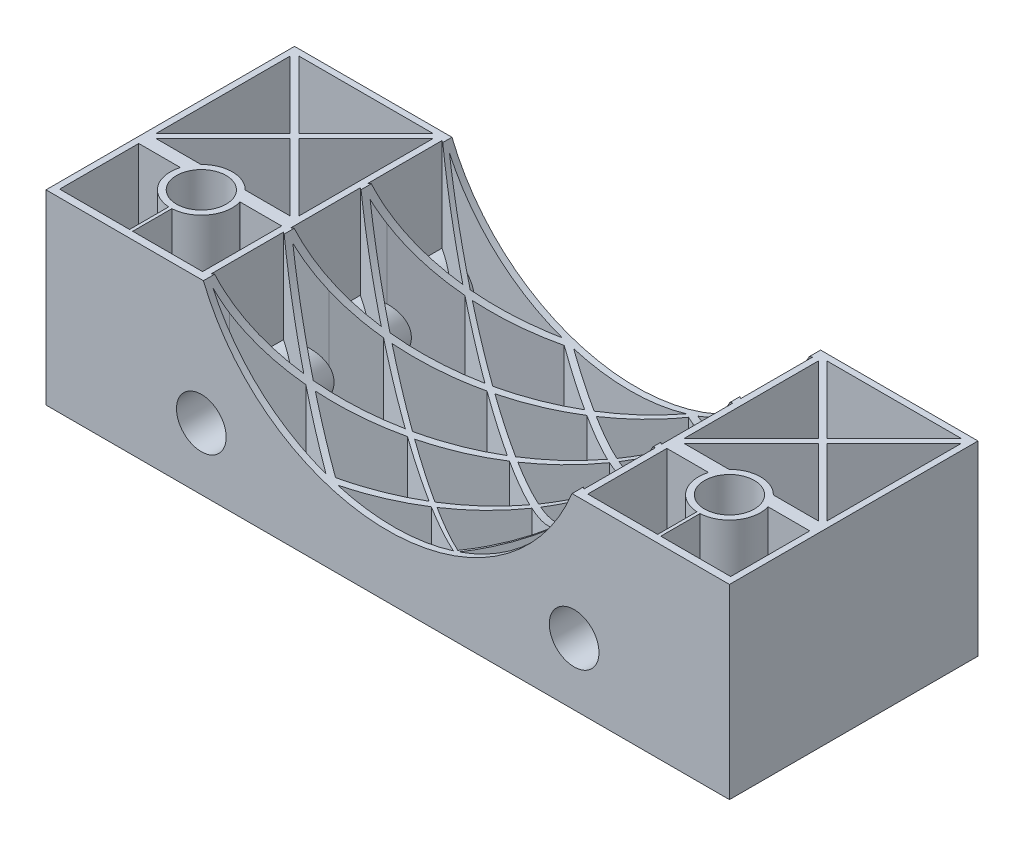
from build123d import *

# Parameters (mm, degrees)
SKETCH1_W           = 110
SKETCH1_H           = 40
BOSS_EXTRUDE1_DEPTH = 30
SKETCH2_R           = 32
CUT_EXTRUDE1_DEPTH  = 40
SKETCH3_R           = 4
CUT_EXTRUDE3_DEPTH  = 30
SKETCH7_R           = 4
CUT_EXTRUDE6_DEPTH  = 40
CUT_EXTRUDE7_DEPTH  = 30
CUT_EXTRUDE9_DEPTH  = 30
SKETCH12_R          = 5
BOSS_EXTRUDE3_DEPTH = 40
SKETCH15_R          = 4
CUT_EXTRUDE10_DEPTH = 40


with BuildPart() as part:
    # Sketch1 → Boss-Extrude1 (new body)
    with BuildSketch(Plane(origin=(0, 0, 0), x_dir=(1, 0, 0), z_dir=(0, 1, 0))):
        with Locations((55, 20)):
            Rectangle(SKETCH1_W, SKETCH1_H)
    extrude(amount=BOSS_EXTRUDE1_DEPTH)

    # Sketch2 → Cut-Extrude1 (cut)
    with BuildSketch(Plane.XY):
        with Locations((55, 42)):
            Circle(SKETCH2_R)
    extrude(amount=-CUT_EXTRUDE1_DEPTH, mode=Mode.SUBTRACT)

    # Sketch3 → Cut-Extrude3 (cut)
    with BuildSketch(Plane.XZ):
        with Locations(Location((12.5, -12.5, 0), (0, 0, 270))):
            Circle(SKETCH3_R)
    cut_extrude3 = extrude(amount=-CUT_EXTRUDE3_DEPTH, mode=Mode.SUBTRACT)

    # Mirror1: Cut-Extrude3 across plane
    add(cut_extrude3.mirror(Plane(origin=(55, 0, 0), x_dir=(0, 0, 1), z_dir=(1, 0, 0))), mode=Mode.SUBTRACT)

    # Sketch7 → Cut-Extrude6 (cut)
    with BuildSketch(Plane.XY):
        with Locations((25, 10)):
            Circle(SKETCH7_R)
        with Locations(Location((85, 10, 0), (0, 0, 180))):
            Circle(SKETCH7_R)
    extrude(amount=-CUT_EXTRUDE6_DEPTH, mode=Mode.SUBTRACT)

    # Sketch9 → Cut-Extrude7 (cut)
    with BuildSketch(Plane.XZ):
        Polygon((1.707106781, -39), (12.5, -28.207106781), (23.292893219, -39), (21.79125531, -39), align=None)
        Polygon((1, -16.707106781), (11.792893219, -27.5), (1, -38.292893219), (1, -36.79125531), align=None)
        with BuildLine():
            Line((23.292893219, -16), (12.5, -26.792893219))
            Line((12.5, -26.792893219), (1.707106781, -16))
            Line((1.707106781, -16), (8.929285786, -16))
            ThreePointArc((8.929285786, -16), (12.5, -17.5), (16.070714214, -16))
            Line((16.070714214, -16), (23.292893219, -16))
        make_face()
        Polygon((24, -38.292893219), (13.207106781, -27.5), (24, -16.707106781), (24, -18.20874469), align=None)
        with BuildLine():
            Line((12.25, -1.199621128), (1, -1.199621128))
            Line((1, -1.199621128), (1, -13.924921606))
            Line((1, -13.924921606), (7.707339109, -13.924921606))
            Line((7.707339109, -13.924921606), (7.68918539, -13.862373953))
            ThreePointArc((7.68918539, -13.862373953), (8.437608263, -9.585043161), (12.25, -7.506253911))
            Line((12.25, -7.506253911), (12.25, -1.199621128))
        make_face()
        with BuildLine():
            Line((17.292660891, -13.924921606), (17.31081461, -13.862373953))
            ThreePointArc((17.31081461, -13.862373953), (16.562391737, -9.585043161), (12.75, -7.506253911))
            Line((12.75, -7.506253911), (12.75, -1.199621128))
            Line((12.75, -1.199621128), (24, -1.199621128))
            Line((24, -1.199621128), (24, -13.924921606))
            Line((24, -13.924921606), (17.292660891, -13.924921606))
        make_face()
        with BuildLine():
            Line((97.25, -1.199621128), (86, -1.199621128))
            Line((86, -1.199621128), (86, -13.924921606))
            Line((86, -13.924921606), (92.707339109, -13.924921606))
            Line((92.707339109, -13.924921606), (92.68918539, -13.862373953))
            ThreePointArc((92.68918539, -13.862373953), (93.437608263, -9.585043161), (97.25, -7.506253911))
            Line((97.25, -7.506253911), (97.25, -1.199621128))
        make_face()
        with BuildLine():
            Line((102.292660891, -13.924921606), (102.31081461, -13.862373953))
            ThreePointArc((102.31081461, -13.862373953), (101.562391737, -9.585043161), (97.75, -7.506253911))
            Line((97.75, -7.506253911), (97.75, -1.199621128))
            Line((97.75, -1.199621128), (109, -1.199621128))
            Line((109, -1.199621128), (109, -13.924921606))
            Line((109, -13.924921606), (102.292660891, -13.924921606))
        make_face()
        with BuildLine():
            Line((93.929285786, -16), (86.707106781, -16))
            Line((86.707106781, -16), (97.5, -26.792893219))
            Line((97.5, -26.792893219), (108.292893219, -16))
            Line((108.292893219, -16), (101.070714214, -16))
            ThreePointArc((101.070714214, -16), (97.5, -17.5), (93.929285786, -16))
        make_face()
        Polygon((86, -38.292893219), (86, -18.20874469), (86, -16.707106781), (96.792893219, -27.5), align=None)
        Polygon((109, -16.707106781), (109, -36.79125531), (109, -38.292893219), (98.207106781, -27.5), align=None)
        Polygon((86.707106781, -39), (88.20874469, -39), (108.292893219, -39), (97.5, -28.207106781), align=None)
    extrude(amount=-CUT_EXTRUDE7_DEPTH, mode=Mode.SUBTRACT)

    # Sketch11 → Cut-Extrude9 (cut)
    with BuildSketch(Plane.XZ):
        Polygon((74.831777691, -6.870491009), (84.013970911, -1), (65.436435115, -1), align=None)
        Polygon((85, -13.007711008), (85, -1.591842697), (75.754730915, -7.447179784), (84.828397962, -13.116678302), align=None)
        Polygon((74.303109193, -7.20848691), (65.00347679, -1.276449032), (55.748894389, -7.18560979), (65.113625115, -13.083639214), align=None)
        Polygon((55.184396802, -6.830081855), (64.570088732, -1), (45.92755138, -1), align=None)
        Polygon((75.037558184, -19.333861561), (84.195449509, -13.51860057), (75.214092745, -7.789583958), (65.986768251, -13.633556138), align=None)
        Polygon((85, -25.608337217), (85, -14.03180623), (81.349745928, -16.510200328), (75.974121895, -19.923721588), align=None)
        Polygon((47.722877132, -3.306365214), (45.005975516, -1.589808553), (35.983357785, -7.364283901), (45.064941258, -13.115953433), (54.24364247, -7.414447377), align=None)
        Polygon((64.184872748, -13.677422452), (54.820920186, -7.778132338), (45.765881351, -13.559882159), (55.111159638, -19.478558407), align=None)
        Polygon((74.104156828, -19.926571422), (65.053474994, -14.224641867), (55.934488469, -20), (64.973366916, -25.724623017), align=None)
        Polygon((35.050950115, -6.773759043), (44.07244862, -1), (25.860015592, -1), (27.529634929, -2.010259425), align=None)
        Polygon((80.649584856, -28.390632809), (84.068474608, -26.204091624), (75.040582112, -20.516519351), (65.907331161, -26.316133705), (74.946238074, -32.04077475), align=None)
        Polygon((54.181077526, -20.073191796), (44.835197816, -14.154134647), (35.728490581, -19.968875355), (45.103769575, -25.876626056), align=None)
        Polygon((85, -38.408157303), (85, -26.790952621), (82.228397155, -28.567458704), (75.878645743, -32.631299607), align=None)
        Polygon((64.040106421, -26.31724343), (55, -20.591842697), (45.881647659, -26.36679918), (54.956574992, -32.085285888), align=None)
        Polygon((44.12138996, -13.702056338), (35.053761926, -7.95922525), (28.423168594, -12.202804983), (25.932883022, -13.794637913), (29.509301375, -16.049907246), (34.886630018, -19.438384226), align=None)
        Polygon((34.121354257, -7.368700393), (25, -1.591842697), (25, -13.206367117), align=None)
        Polygon((44.174383673, -26.470814335), (34.797457648, -20.563350939), (25.961839119, -26.204998289), (27.626895365, -27.28758015), (35.257903909, -32.171425619), align=None)
        Polygon((66.85354378, -37.220099098), (74.016642215, -32.635716099), (64.974070666, -26.908754119), (55.892895673, -32.67530024), (64.990420354, -38.408026471), align=None)
        Polygon((54.025105444, -32.676769051), (44.947934097, -26.958151102), (35.983357785, -32.635716099), (45.001054032, -38.407041698), align=None)
        Polygon((25, -25.579632277), (33.942595105, -20.024787537), (25, -14.390952621), align=None)
        Polygon((65.929850142, -39), (84.065511531, -39), (74.949049885, -33.226240957), (67.451195268, -38.024867912), align=None)
        Polygon((25, -38.729655361), (34.329869874, -32.764749603), (26.854833561, -27.980726362), (25, -26.819143988), align=None)
        Polygon((64.061979967, -39), (54.961530728, -33.26671698), (47.140316953, -38.233187727), (45.92755138, -39), align=None)
        Polygon((42.539405901, -38.01885266), (35.050950115, -33.226240957), (25.934488469, -39), (44.06726143, -39), align=None)
    extrude(amount=-CUT_EXTRUDE9_DEPTH, mode=Mode.SUBTRACT)

    # Sketch12 → Boss-Extrude3 (add)
    with BuildSketch(Plane.XY):
        with Locations((25, 10)):
            Circle(SKETCH12_R)
        with Locations((85, 10)):
            Circle(SKETCH12_R)
    extrude(amount=-BOSS_EXTRUDE3_DEPTH)

    # Sketch15 → Cut-Extrude10 (cut)
    with BuildSketch(Plane.XY):
        with Locations((25, 10)):
            Circle(SKETCH15_R)
        with Locations(Location((85, 10, 0), (0, 0, 180))):
            Circle(SKETCH15_R)
    extrude(amount=-CUT_EXTRUDE10_DEPTH, mode=Mode.SUBTRACT)


solid = part.part
